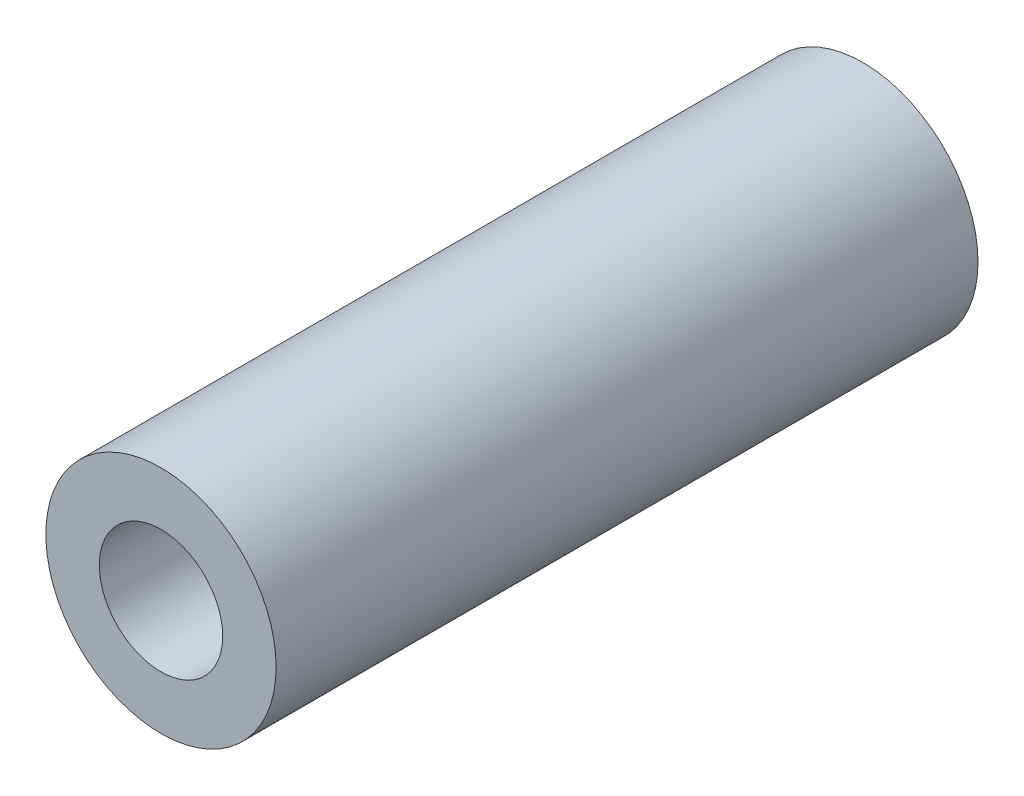
from build123d import *

# Parameters (mm, degrees)
SKETCH1_R           = 4.7625
SKETCH1_R_2         = 2.5527
BOSS_EXTRUDE1_DEPTH = 14.516735


with BuildPart() as part:
    # Sketch1 → Boss-Extrude1 (new, symmetric)
    with BuildSketch(Plane.XY):
        Circle(SKETCH1_R)
        Circle(SKETCH1_R_2, mode=Mode.SUBTRACT)
    extrude(amount=BOSS_EXTRUDE1_DEPTH, both=True)


solid = part.part
